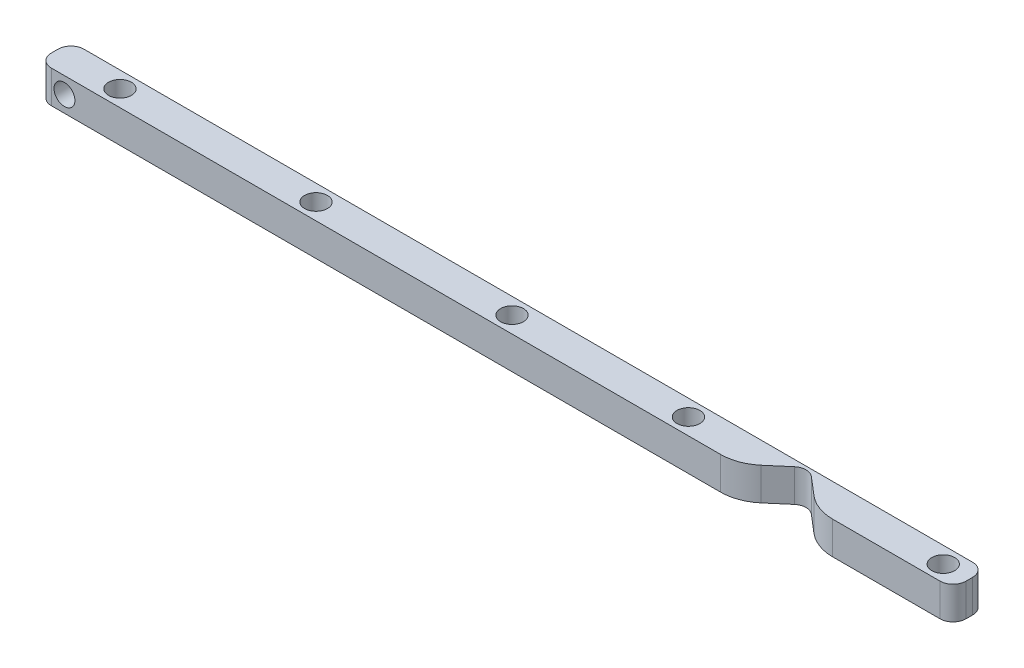
from build123d import *

# Parameters (mm, degrees)
SKETCH1_W           = 177.8
SKETCH1_H           = 6.35
BOSS_EXTRUDE1_DEPTH = 6.35
FILLET1_R           = 2.54
CUT_EXTRUDE1_REACH  = 91.183
SKETCH2_R           = 2.2225
CUT_EXTRUDE2_REACH  = 91.352
SKETCH3_R           = 2.032
CUT_EXTRUDE3_REACH  = 91.183
FILLET2_R           = 8.89


with BuildPart() as part:
    # Sketch1 → Boss-Extrude1 (new body)
    with BuildSketch(Plane(origin=(0, 0, 0), x_dir=(1, 0, 0), z_dir=(0, 1, 0))):
        Rectangle(SKETCH1_W, SKETCH1_H)
    extrude(amount=BOSS_EXTRUDE1_DEPTH)

    # Fillet1
    fillet1_edges = [part.edges().sort_by_distance(p)[0] for p in [
        (88.9, 3.175, -3.175),
        (88.9, 3.175, 3.175),
        (-88.9, 3.175, -3.175),
        (-88.9, 3.175, 3.175),
    ]]
    fillet(fillet1_edges, radius=FILLET1_R)

    # Sketch2 → Cut-Extrude1 (cut, up to next)
    with BuildSketch(Plane(origin=(0, 6.35, 0), x_dir=(1, 0, 0), z_dir=(0, 1, 0)), mode=Mode.PRIVATE) as cut_extrude1_sk1:
        with Locations((-76.2, 0)):
            Circle(SKETCH2_R)
    cut_extrude1_tool1 = extrude(cut_extrude1_sk1.sketch, amount=-CUT_EXTRUDE1_REACH, mode=Mode.PRIVATE) & part.part
    # Sketch2 → Cut-Extrude1 (cut, up to next)
    with BuildSketch(Plane(origin=(0, 6.35, 0), x_dir=(1, 0, 0), z_dir=(0, 1, 0)), mode=Mode.PRIVATE) as cut_extrude1_sk2:
        with Locations((83.82, 0)):
            Circle(SKETCH2_R)
    cut_extrude1_tool2 = extrude(cut_extrude1_sk2.sketch, amount=-CUT_EXTRUDE1_REACH, mode=Mode.PRIVATE) & part.part
    # Sketch2 → Cut-Extrude1 (cut, up to next)
    with BuildSketch(Plane(origin=(0, 6.35, 0), x_dir=(1, 0, 0), z_dir=(0, 1, 0)), mode=Mode.PRIVATE) as cut_extrude1_sk3:
        with Locations((34.29, 0)):
            Circle(SKETCH2_R)
    cut_extrude1_tool3 = extrude(cut_extrude1_sk3.sketch, amount=-CUT_EXTRUDE1_REACH, mode=Mode.PRIVATE) & part.part
    # Sketch2 → Cut-Extrude1 (cut, up to next)
    with BuildSketch(Plane(origin=(0, 6.35, 0), x_dir=(1, 0, 0), z_dir=(0, 1, 0)), mode=Mode.PRIVATE) as cut_extrude1_sk4:
        with Locations((-38.1, 0)):
            Circle(SKETCH2_R)
    cut_extrude1_tool4 = extrude(cut_extrude1_sk4.sketch, amount=-CUT_EXTRUDE1_REACH, mode=Mode.PRIVATE) & part.part
    # Sketch2 → Cut-Extrude1 (cut, up to next)
    with BuildSketch(Plane(origin=(0, 6.35, 0), x_dir=(1, 0, 0), z_dir=(0, 1, 0)), mode=Mode.PRIVATE) as cut_extrude1_sk5:
        Circle(SKETCH2_R)
    cut_extrude1_tool5 = extrude(cut_extrude1_sk5.sketch, amount=-CUT_EXTRUDE1_REACH, mode=Mode.PRIVATE) & part.part
    add(cut_extrude1_tool1.solids().sort_by_distance((-76.2, 6.35, 0))[0], mode=Mode.SUBTRACT)
    add(cut_extrude1_tool2.solids().sort_by_distance((83.82, 6.35, 0))[0], mode=Mode.SUBTRACT)
    add(cut_extrude1_tool3.solids().sort_by_distance((34.29, 6.35, 0))[0], mode=Mode.SUBTRACT)
    add(cut_extrude1_tool4.solids().sort_by_distance((-38.1, 6.35, 0))[0], mode=Mode.SUBTRACT)
    add(cut_extrude1_tool5.solids().sort_by_distance((0, 6.35, 0))[0], mode=Mode.SUBTRACT)

    # Sketch3 → Cut-Extrude2 (cut, up to next)
    with BuildSketch(Plane.XY.offset(3.175), mode=Mode.PRIVATE) as cut_extrude2_sk1:
        with Locations((-83.82, 3.175)):
            Circle(SKETCH3_R)
    cut_extrude2_tool1 = extrude(cut_extrude2_sk1.sketch, amount=-CUT_EXTRUDE2_REACH, mode=Mode.PRIVATE) & part.part
    add(cut_extrude2_tool1.solids().sort_by_distance((-83.82, 3.175, 3.175))[0], mode=Mode.SUBTRACT)

    # Sketch4 → Cut-Extrude3 (cut, up to next)
    with BuildSketch(Plane(origin=(0, 6.35, 0), x_dir=(1, 0, 0), z_dir=(0, 1, 0)), mode=Mode.PRIVATE) as cut_extrude3_sk1:
        with BuildLine():
            Line((62.23, -3.175), (56.260948665, 1.930276795))
            ThreePointArc((56.260948665, 1.930276795), (54.61, 2.54), (52.959051335, 1.930276795))
            Line((52.959051335, 1.930276795), (46.99, -3.175))
            Line((46.99, -3.175), (62.23, -3.175))
        make_face()
    cut_extrude3_tool1 = extrude(cut_extrude3_sk1.sketch, amount=-CUT_EXTRUDE3_REACH, mode=Mode.PRIVATE) & part.part
    add(cut_extrude3_tool1.solids().sort_by_distance((54.61, 6.35, 1.075499))[0], mode=Mode.SUBTRACT)

    # Fillet2
    fillet2_edges = [part.edges().sort_by_distance(p)[0] for p in [
        (62.23, 3.175, 3.175),
        (46.99, 3.175, 3.175),
    ]]
    fillet(fillet2_edges, radius=FILLET2_R)


solid = part.part
